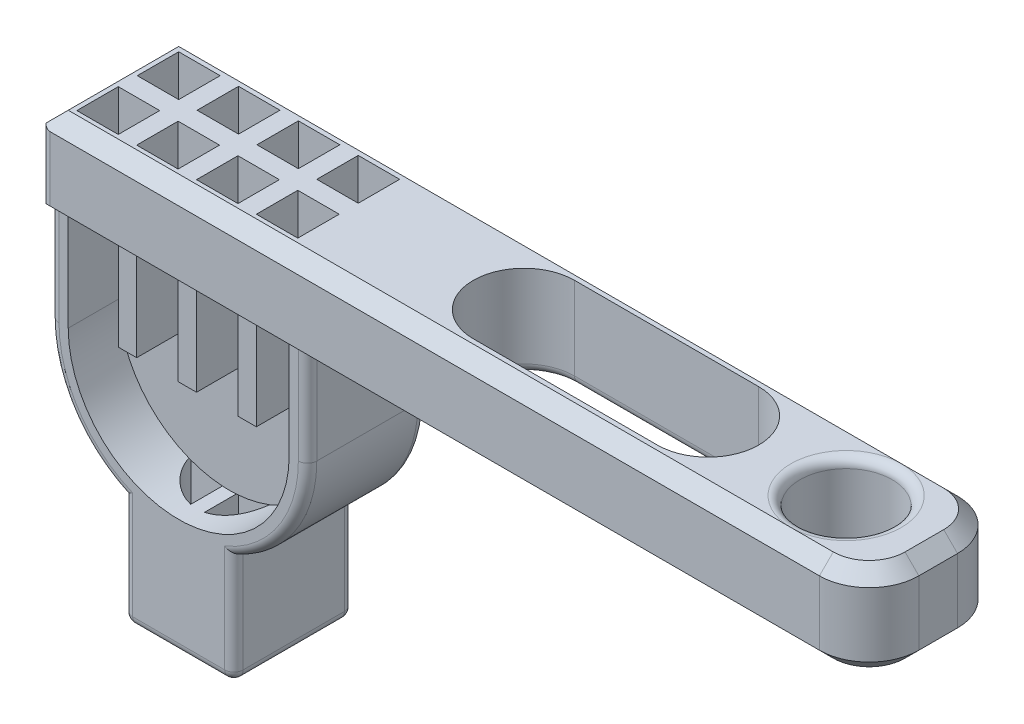
from build123d import *

# Parameters (mm, degrees)
SKETCH1_R                 = 0.5
BOSS_EXTRUDE1_DEPTH       = 1
FILLET1_R                 = 0.1
FILLET3_R                 = 0.54
CHAMFER2_SIZE             = 0.15
CUT_EXTRUDE3_DEPTH        = 1
FILLET4_R                 = 0.1
SKETCH14_3_W              = 0.45
SKETCH14_3_H              = 0.45
CUT_EXTRUDE4_DEPTH        = 10
SKETCH14_W                = 0.2
SKETCH14_H                = 0.2
SKETCH14_H_2              = 0.193588387
SKETCH14_H_3              = 0.45
BOSS_EXTRUDE7_DEPTH       = 1
BOSS_EXTRUDE12_DEPTH      = 0.65
BOSS_EXTRUDE12_DEPTH_BACK = 0.85
BOSS_EXTRUDE13_DEPTH      = 1.5
CUT_EXTRUDE7_DEPTH        = 0.1
CUT_EXTRUDE8_START        = -0.1
CUT_EXTRUDE8_DEPTH        = 0.1
CUT_EXTRUDE9_DEPTH        = 1.35
CHAMFER3_SIZE             = 0.15
FILLET7_R                 = 0.1
BOSS_EXTRUDE14_START      = -0.2
BOSS_EXTRUDE14_DEPTH      = 0.2


with BuildPart() as part:
    # Sketch1 → Boss-Extrude1 (new body)
    with BuildSketch(Plane(origin=(0, 0, 0), x_dir=(1, 0, 0), z_dir=(0, 1, 0))):
        Polygon((1, 0.75), (-2, 0.75), (-8, 0.75), (-8, -0.75), (-2, -0.75), (1, -0.75), align=None)
        with Locations(Location((0, 0, 0), (0, 0, 270))):
            Circle(SKETCH1_R, mode=Mode.SUBTRACT)
    extrude(amount=BOSS_EXTRUDE1_DEPTH)

    # Fillet1
    fillet1_edges = [part.edges().sort_by_distance(p)[0] for p in [
        (0, 1, -0.5),
        (0, 0, -0.5),
    ]]
    fillet(fillet1_edges, radius=FILLET1_R)

    # Fillet3
    fillet3_edges = [part.edges().sort_by_distance(p)[0] for p in [
        (1, 0.5, -0.75),
        (1, 0.5, 0.75),
    ]]
    fillet(fillet3_edges, radius=FILLET3_R)

    # Chamfer2
    chamfer2_edges = [part.edges().sort_by_distance(p)[0] for p in [
        (-8, 1, 0),
        (-3.77, 1, 0.75),
        (-3.77, 1, -0.75),
        (1, 1, 0),
        (0.841837662, 1, 0.591837662),
        (0.841837662, 1, -0.591837662),
    ]]
    chamfer(chamfer2_edges, length=CHAMFER2_SIZE - 0.0001)  # a hair under: the kernel refuses the full size

    # Sketch13 → Cut-Extrude3 (cut)
    with BuildSketch(Plane.XZ):
        with BuildLine():
            Line((-1.5, -0.55), (-3.5, -0.55))
            ThreePointArc((-3.5, -0.55), (-4.05, 0), (-3.5, 0.55))
            Line((-3.5, 0.55), (-1.5, 0.55))
            ThreePointArc((-1.5, 0.55), (-0.95, 0), (-1.5, -0.55))
        make_face()
    extrude(amount=-CUT_EXTRUDE3_DEPTH, mode=Mode.SUBTRACT)

    # Fillet4
    fillet4_edges = [part.edges().sort_by_distance(p)[0] for p in [
        (-0.95, 0, 0),
        (-2.5, 0, 0.55),
        (-4.05, 0, 0),
        (-2.5, 0, -0.55),
    ]]
    fillet(fillet4_edges, radius=FILLET4_R)

    # Sketch14<3> → Cut-Extrude4 (cut)
    with BuildSketch(Plane.XZ):
        with Locations((-7.575, 0.331411613)):
            Rectangle(SKETCH14_3_W, SKETCH14_3_H)
        with Locations((-6.275, 0.331411613)):
            Rectangle(SKETCH14_3_W, SKETCH14_3_H)
        with Locations((-6.275, -0.325)):
            Rectangle(SKETCH14_3_W, SKETCH14_3_H)
        with Locations((-5.625, 0.331411613)):
            Rectangle(SKETCH14_3_W, SKETCH14_3_H)
        with Locations((-7.575, -0.325)):
            Rectangle(SKETCH14_3_W, SKETCH14_3_H)
        with Locations((-6.925, -0.325)):
            Rectangle(SKETCH14_3_W, SKETCH14_3_H)
        with Locations((-6.925, 0.331411613)):
            Rectangle(SKETCH14_3_W, SKETCH14_3_H)
        with Locations((-5.625, -0.325)):
            Rectangle(SKETCH14_3_W, SKETCH14_3_H)
    extrude(amount=-CUT_EXTRUDE4_DEPTH, mode=Mode.SUBTRACT)


with BuildPart() as body_2:
    # Sketch14 → Boss-Extrude7 (new body)
    with BuildSketch(Plane.XZ):
        Polygon((-7.8, -0.55), (-7.8, -0.1), (-7.8, 0.106411613), (-7.8, 0.556411613), (-8, 0.556411613), (-8, -0.55), align=None)
        Polygon((-7.8, 0.106411613), (-7.8, -0.1), (-7.35, -0.1), (-7.35, -0.55), (-7.15, -0.55), (-7.15, -0.1), (-6.7, -0.1), (-6.7, -0.55), (-6.5, -0.55), (-6.5, -0.1), (-6.05, -0.1), (-6.05, -0.55), (-5.85, -0.55), (-5.85, -0.1), (-5.4, -0.1), (-5.4, 0.106411613), (-5.85, 0.106411613), (-5.85, 0.556411613), (-6.05, 0.556411613), (-6.05, 0.106411613), (-6.5, 0.106411613), (-6.5, 0.556411613), (-6.7, 0.556411613), (-6.7, 0.106411613), (-7.15, 0.106411613), (-7.15, 0.556411613), (-7.35, 0.556411613), (-7.35, 0.106411613), align=None)
        with Locations((-7.9, -0.65)):
            Rectangle(SKETCH14_W, SKETCH14_H)
        with Locations((-7.9, 0.653205807)):
            Rectangle(SKETCH14_W, SKETCH14_H_2)
        with Locations((-5.3, -0.65)):
            Rectangle(SKETCH14_W, SKETCH14_H)
        with Locations((-5.3, -0.325)):
            Rectangle(SKETCH14_W, SKETCH14_H_3)
        Polygon((-5.4, 0.106411613), (-5.4, -0.1), (-5.2, -0.1), (-5.2, 0.556411613), (-5.4, 0.556411613), align=None)
        with Locations((-5.3, 0.653205807)):
            Rectangle(SKETCH14_W, SKETCH14_H_2)
    extrude(amount=BOSS_EXTRUDE7_DEPTH)


with BuildPart() as part_1:
    add(part.part)

    # Intersect1: read off the stored shape, not the designer's step
    # Intersect1: union body 2
    add(body_2.part)

    # Sketch22 → Boss-Extrude12 (add, two sides: drawn at the far end of the back side and taken through both)
    with BuildSketch(Plane(origin=(0, 0, -0.1), x_dir=(-1, 0, 0), z_dir=(0, 0, -1)).offset(-BOSS_EXTRUDE12_DEPTH_BACK)):
        with BuildLine():
            Line((7.8, -1), (8, -1))
            ThreePointArc((8, -1), (6.6, -2.4), (5.2, -1))
            Line((5.2, -1), (5.4, -1))
            ThreePointArc((5.4, -1), (6.6, -2.2), (7.8, -1))
        make_face()
    extrude(amount=BOSS_EXTRUDE12_DEPTH + BOSS_EXTRUDE12_DEPTH_BACK)

    # 3DSketch1 → Boss-Extrude13 (add)
    with BuildSketch(Plane(origin=(-7.2, -3.464911064, 0.75), x_dir=(0.7071067811865475, 0.7071067811865477, 0), z_dir=(0, 0, -1))):
        Polygon((0, 0), (0.848528137, 0.848528137), (1.697056275, 0), (0.848528137, -0.848528137), align=None)
    extrude(amount=BOSS_EXTRUDE13_DEPTH)

    # Sketch25 → Cut-Extrude7 (cut)
    with BuildSketch(Plane.XY.offset(0.75)):
        with BuildLine():
            Line((-7.8, -1), (-7.8, 0))
            Line((-7.8, 0), (-8, 0))
            Line((-8, 0), (-8, -1))
            ThreePointArc((-8, -1), (-7.783215957, -1.748331477), (-7.2, -2.264911064))
            Line((-7.2, -2.264911064), (-7.2, -3.464911064))
            Line((-7.2, -3.464911064), (-6, -3.464911064))
            Line((-6, -3.464911064), (-6, -2.264911064))
            ThreePointArc((-6, -2.264911064), (-5.416784043, -1.748331477), (-5.2, -1))
            Line((-5.2, -1), (-5.2, 0))
            Line((-5.2, 0), (-5.4, 0))
            Line((-5.4, 0), (-5.4, -1))
            ThreePointArc((-5.4, -1), (-6.6, -2.2), (-7.8, -1))
        make_face()
    extrude(amount=-CUT_EXTRUDE7_DEPTH, mode=Mode.SUBTRACT)

    # Sketch29 → Cut-Extrude8 (cut)
    with BuildSketch(Plane(origin=(0, 0, -0.75), x_dir=(-1, 0, 0), z_dir=(0, 0, -1)).offset(CUT_EXTRUDE8_START)):
        with BuildLine():
            Line((8, 0), (7.8, 0))
            Line((7.8, 0), (7.8, -1))
            ThreePointArc((7.8, -1), (6.6, -2.2), (5.4, -1))
            Line((5.4, -1), (5.4, 0))
            Line((5.4, 0), (5.2, 0))
            Line((5.2, 0), (5.2, -1))
            ThreePointArc((5.2, -1), (5.416784043, -1.748331477), (6, -2.264911064))
            Line((6, -2.264911064), (6, -3.464911064))
            Line((6, -3.464911064), (7.2, -3.464911064))
            Line((7.2, -3.464911064), (7.2, -2.264911064))
            ThreePointArc((7.2, -2.264911064), (7.783215957, -1.748331477), (8, -1))
            Line((8, -1), (8, 0))
        make_face()
    extrude(amount=CUT_EXTRUDE8_DEPTH, mode=Mode.SUBTRACT)

    # Sketch23 → Cut-Extrude9 (cut)
    with BuildSketch(Plane.XZ.offset(3.464911064)):
        with BuildLine():
            Line((-6.525, 0.443705984), (-6.525, 0.075))
            Line((-6.525, 0.075), (-6.156294016, 0.075))
            ThreePointArc((-6.156294016, 0.075), (-6.281801948, 0.318198052), (-6.525, 0.443705984))
        make_face()
        with BuildLine():
            Line((-6.156294016, -0.075), (-6.525, -0.075))
            Line((-6.525, -0.075), (-6.525, -0.443705984))
            ThreePointArc((-6.525, -0.443705984), (-6.281801948, -0.318198052), (-6.156294016, -0.075))
        make_face()
        with BuildLine():
            Line((-6.675, -0.075), (-7.043705984, -0.075))
            ThreePointArc((-7.043705984, -0.075), (-6.918198052, -0.318198052), (-6.675, -0.443705984))
            Line((-6.675, -0.443705984), (-6.675, -0.075))
        make_face()
        with BuildLine():
            ThreePointArc((-6.675, 0.443705984), (-6.918198052, 0.318198052), (-7.043705984, 0.075))
            Line((-7.043705984, 0.075), (-6.675, 0.075))
            Line((-6.675, 0.075), (-6.675, 0.443705984))
        make_face()
    extrude(amount=-CUT_EXTRUDE9_DEPTH, mode=Mode.SUBTRACT)

    # Chamfer3
    # the kernel refuses this chamfer: 0.15 mm, written as the material it takes off along each edge
    with BuildSketch(Plane(origin=(0.46, 0, 0.75), x_dir=(0, 0, -1), z_dir=(-1, 0, 0))) as chamfer3_piece_1_section:
        Polygon((CHAMFER3_SIZE, 0), (0, -CHAMFER3_SIZE), (0, 0), align=None)
    chamfer3_piece_1 = extrude(amount=8.845752448, mode=Mode.PRIVATE)
    chamfer3_piece_1 = split(chamfer3_piece_1, bisect_by=Plane(origin=(-5.2, 0, 0.75), z_dir=(1, 0, 0)), keep=Keep.TOP, mode=Mode.PRIVATE)
    add(chamfer3_piece_1, mode=Mode.SUBTRACT)
    with BuildSketch(Plane(origin=(0.46, 0, 0.75), x_dir=(0, 0, -1), z_dir=(-1, 0, 0))) as chamfer3_piece_2_section:
        Polygon((CHAMFER3_SIZE, 0), (0, -CHAMFER3_SIZE), (0, 0), align=None)
    chamfer3_piece_2 = extrude(amount=8.845752448, mode=Mode.PRIVATE)
    chamfer3_piece_2 = split(chamfer3_piece_2, bisect_by=Plane(origin=(0.46, 0, 0.65), z_dir=(0, 0, 1)), keep=Keep.TOP, mode=Mode.PRIVATE)
    add(chamfer3_piece_2, mode=Mode.SUBTRACT)
    with BuildSketch(Plane(origin=(0.46, 0, 0.75), x_dir=(0, 0, -1), z_dir=(-1, 0, 0))) as chamfer3_piece_3_section:
        Polygon((CHAMFER3_SIZE, 0), (0, -CHAMFER3_SIZE), (0, 0), align=None)
    chamfer3_piece_3 = extrude(amount=8.845752448, mode=Mode.PRIVATE)
    chamfer3_piece_3 = split(chamfer3_piece_3, bisect_by=Plane(origin=(-5.4, 0, 0.75), z_dir=(-1, 0, 0)), keep=Keep.TOP, mode=Mode.PRIVATE)
    chamfer3_piece_3 = split(chamfer3_piece_3, bisect_by=Plane(origin=(-7.8, 0, 0.75), z_dir=(1, 0, 0)), keep=Keep.TOP, mode=Mode.PRIVATE)
    add(chamfer3_piece_3, mode=Mode.SUBTRACT)
    with BuildSketch(Plane(origin=(0.46, 0, 0.21), x_dir=(0, 0, 1), z_dir=(-1, 0, 0))) as chamfer3_piece_4:
        Polygon((0.54 - CHAMFER3_SIZE, 0), (0.54, CHAMFER3_SIZE), (0.54, 0), align=None)
    revolve(axis=Axis((0.46, 0, 0.21), (0, 1, 0)), revolution_arc=90, mode=Mode.SUBTRACT)
    with BuildSketch(Plane(origin=(1, 0, 0.21), x_dir=(-1, 0, 0), z_dir=(0, 0, -1))) as chamfer3_piece_5:
        Polygon((CHAMFER3_SIZE, 0), (0, CHAMFER3_SIZE), (0, 0), align=None)
    extrude(amount=0.42, mode=Mode.SUBTRACT)
    with BuildSketch(Plane(origin=(0.46, 0, -0.21), x_dir=(0, 0, -1), z_dir=(-1, 0, 0))) as chamfer3_piece_6:
        Polygon((0.54 - CHAMFER3_SIZE, 0), (0.54, -CHAMFER3_SIZE), (0.54, 0), align=None)
    revolve(axis=Axis((0.46, 0, -0.21), (0, -1, 0)), revolution_arc=90, mode=Mode.SUBTRACT)
    with BuildSketch(Plane(origin=(-8.385752448, 0, -0.75), x_dir=(0, 0, 1), z_dir=(1, 0, 0))) as chamfer3_piece_7_section:
        Polygon((CHAMFER3_SIZE, 0), (0, -CHAMFER3_SIZE), (0, 0), align=None)
    chamfer3_piece_7 = extrude(amount=8.845752448, mode=Mode.PRIVATE)
    chamfer3_piece_7 = split(chamfer3_piece_7, bisect_by=Plane(origin=(-7.8, 0, -0.75), z_dir=(1, 0, 0)), keep=Keep.TOP, mode=Mode.PRIVATE)
    chamfer3_piece_7 = split(chamfer3_piece_7, bisect_by=Plane(origin=(-5.4, 0, -0.75), z_dir=(-1, 0, 0)), keep=Keep.TOP, mode=Mode.PRIVATE)
    add(chamfer3_piece_7, mode=Mode.SUBTRACT)
    with BuildSketch(Plane(origin=(-8.385752448, 0, -0.75), x_dir=(0, 0, 1), z_dir=(1, 0, 0))) as chamfer3_piece_8_section:
        Polygon((CHAMFER3_SIZE, 0), (0, -CHAMFER3_SIZE), (0, 0), align=None)
    chamfer3_piece_8 = extrude(amount=8.845752448, mode=Mode.PRIVATE)
    chamfer3_piece_8 = split(chamfer3_piece_8, bisect_by=Plane(origin=(-8.385752448, 0, -0.65), z_dir=(0, 0, -1)), keep=Keep.TOP, mode=Mode.PRIVATE)
    add(chamfer3_piece_8, mode=Mode.SUBTRACT)
    with BuildSketch(Plane(origin=(-8.385752448, 0, -0.75), x_dir=(0, 0, 1), z_dir=(1, 0, 0))) as chamfer3_piece_9_section:
        Polygon((CHAMFER3_SIZE, 0), (0, -CHAMFER3_SIZE), (0, 0), align=None)
    chamfer3_piece_9 = extrude(amount=8.845752448, mode=Mode.PRIVATE)
    chamfer3_piece_9 = split(chamfer3_piece_9, bisect_by=Plane(origin=(-5.2, 0, -0.75), z_dir=(1, 0, 0)), keep=Keep.TOP, mode=Mode.PRIVATE)
    add(chamfer3_piece_9, mode=Mode.SUBTRACT)

    # Fillet7
    # the kernel refuses this fillet: 0.1 mm, written as the material it takes off along each edge
    with BuildSketch(Plane(origin=(-6.1, -3.364911064, 0.55), x_dir=(0, 0, 1), z_dir=(0, -1, 0))) as fillet7_piece_1_section:
        Polygon((0, 0), (FILLET7_R, 0), (FILLET7_R, -FILLET7_R), (0, -FILLET7_R), align=None)
    fillet7_piece_1 = extrude(amount=FILLET7_R, mode=Mode.PRIVATE)
    fillet7_piece_1 = fillet7_piece_1 - Plane(origin=(-6.1, -3.364911064, 0.55), x_dir=(-0.7071067811865475, 0, -0.7071067811865475), z_dir=(0, -1, 0)) * Sphere(FILLET7_R, mode=Mode.PRIVATE)
    add(fillet7_piece_1, mode=Mode.SUBTRACT)
    with BuildSketch(Plane(origin=(-6.1, -3.364911064, -0.55), x_dir=(0, 0, -1), z_dir=(0, -1, 0))) as fillet7_piece_2_section:
        Polygon((0, 0), (FILLET7_R, 0), (FILLET7_R, FILLET7_R), (0, FILLET7_R), align=None)
    fillet7_piece_2 = extrude(amount=FILLET7_R, mode=Mode.PRIVATE)
    fillet7_piece_2 = fillet7_piece_2 - Plane(origin=(-6.1, -3.364911064, -0.55), x_dir=(-0.7071067811865475, 0, 0.7071067811865475), z_dir=(0, -1, 0)) * Sphere(FILLET7_R, mode=Mode.PRIVATE)
    add(fillet7_piece_2, mode=Mode.SUBTRACT)
    with BuildSketch(Plane(origin=(-7.1, -3.364911064, 0.55), x_dir=(0, 0, 1), z_dir=(0, -1, 0))) as fillet7_piece_3_section:
        Polygon((0, 0), (FILLET7_R, 0), (FILLET7_R, FILLET7_R), (0, FILLET7_R), align=None)
    fillet7_piece_3 = extrude(amount=FILLET7_R, mode=Mode.PRIVATE)
    fillet7_piece_3 = fillet7_piece_3 - Plane(origin=(-7.1, -3.364911064, 0.55), x_dir=(0.7071067811865475, 0, -0.7071067811865475), z_dir=(0, -1, 0)) * Sphere(FILLET7_R, mode=Mode.PRIVATE)
    add(fillet7_piece_3, mode=Mode.SUBTRACT)
    with BuildSketch(Plane(origin=(-7.1, -3.364911064, -0.55), x_dir=(0, 0, -1), z_dir=(0, -1, 0))) as fillet7_piece_4_section:
        Polygon((0, 0), (FILLET7_R, 0), (FILLET7_R, -FILLET7_R), (0, -FILLET7_R), align=None)
    fillet7_piece_4 = extrude(amount=FILLET7_R, mode=Mode.PRIVATE)
    fillet7_piece_4 = fillet7_piece_4 - Plane(origin=(-7.1, -3.364911064, -0.55), x_dir=(0.7071067811865475, 0, 0.7071067811865475), z_dir=(0, -1, 0)) * Sphere(FILLET7_R, mode=Mode.PRIVATE)
    add(fillet7_piece_4, mode=Mode.SUBTRACT)
    with BuildSketch(Plane(origin=(-6, -3.464911064, 0.55), x_dir=(0, 1, 0), z_dir=(0, 0, -1)), Plane(origin=(-7.2, -3.464911064, 0.55), x_dir=(1, 0, 0), z_dir=(0, 0, -1))) as fillet7_piece_5:
        with BuildLine():
            CenterArc((FILLET7_R, -FILLET7_R), FILLET7_R, 90, 90)
            Line((0, -FILLET7_R), (0, 0))
            Line((0, 0), (FILLET7_R, 0))
        make_face()
    extrude(amount=1.1, mode=Mode.SUBTRACT)
    with BuildSketch(Plane(origin=(-5.2, 0.3, 0.65), x_dir=(-1, 0, 0), z_dir=(0, -1, 0))) as fillet7_piece_6_section:
        with BuildLine():
            CenterArc((FILLET7_R, FILLET7_R), FILLET7_R, 180, 90)
            Line((0, FILLET7_R), (0, 0))
            Line((0, 0), (FILLET7_R, 0))
        make_face()
    fillet7_piece_6 = extrude(amount=1.3, mode=Mode.PRIVATE)
    fillet7_piece_6 = split(fillet7_piece_6, bisect_by=Plane(origin=(-5.2, 0.175, 0.775), z_dir=(0, 0.7071067811865476, -0.7071067811865476)), keep=Keep.TOP, mode=Mode.PRIVATE)
    fillet7_piece_6 = split(fillet7_piece_6, bisect_by=Plane(origin=(-5.2, 0, 0.65), z_dir=(0, -1, 0)), keep=Keep.TOP, mode=Mode.PRIVATE)
    add(fillet7_piece_6, mode=Mode.SUBTRACT)
    with BuildSketch(Plane(origin=(-5.2, 0.3, 0.65), x_dir=(-1, 0, 0), z_dir=(0, -1, 0))) as fillet7_piece_7_section:
        with BuildLine():
            CenterArc((FILLET7_R, FILLET7_R), FILLET7_R, 180, 90)
            Line((0, FILLET7_R), (0, 0))
            Line((0, 0), (FILLET7_R, 0))
        make_face()
    fillet7_piece_7 = extrude(amount=1.3, mode=Mode.PRIVATE)
    fillet7_piece_7 = split(fillet7_piece_7, bisect_by=Plane(origin=(-5.2, 0.175, 0.775), z_dir=(0, -0.7071067811865476, 0.7071067811865476)), keep=Keep.TOP, mode=Mode.PRIVATE)
    fillet7_piece_7 = split(fillet7_piece_7, bisect_by=Plane(origin=(-5.2, 0, 0.65), z_dir=(0, 1, 0)), keep=Keep.TOP, mode=Mode.PRIVATE)
    add(fillet7_piece_7, mode=Mode.SUBTRACT)
    with BuildSketch(Plane(origin=(-5.2, 0.3, 0.65), x_dir=(-1, 0, 0), z_dir=(0, -1, 0))) as fillet7_piece_8_section:
        with BuildLine():
            CenterArc((FILLET7_R, FILLET7_R), FILLET7_R, 180, 90)
            Line((0, FILLET7_R), (0, 0))
            Line((0, 0), (FILLET7_R, 0))
        make_face()
    fillet7_piece_8 = extrude(amount=1.3, mode=Mode.PRIVATE)
    fillet7_piece_8 = split(fillet7_piece_8, bisect_by=Plane(origin=(-5.2, 0.175, 0.775), z_dir=(0, -0.7071067811865476, 0.7071067811865476)), keep=Keep.TOP, mode=Mode.PRIVATE)
    fillet7_piece_8 = split(fillet7_piece_8, bisect_by=Plane(origin=(-5.2, 0, 0.65), z_dir=(0, -1, 0)), keep=Keep.TOP, mode=Mode.PRIVATE)
    add(fillet7_piece_8, mode=Mode.SUBTRACT)
    with BuildSketch(Plane(origin=(-6.6, -1, 0.65), x_dir=(0.2612361843672163, -0.9652749121246537, 0), z_dir=(-0.9652749121246537, -0.2612361843672163, 0))) as fillet7_piece_9_section:
        with BuildLine():
            CenterArc((1.4 - FILLET7_R, -FILLET7_R), FILLET7_R, 0, 90)
            Line((1.4, -FILLET7_R), (1.4, 0))
            Line((1.4, 0), (1.4 - FILLET7_R, 0))
        make_face()
    fillet7_piece_9 = revolve(axis=Axis((-6.6, -1, 0.65), (0, 0, 1)), revolution_arc=74.856574406, mode=Mode.PRIVATE)
    fillet7_piece_9 = split(fillet7_piece_9, bisect_by=Plane(origin=(-6, -1, 0.65), z_dir=(1, 0, 0)), keep=Keep.TOP, mode=Mode.PRIVATE)
    add(fillet7_piece_9, mode=Mode.SUBTRACT)
    with BuildSketch(Plane(origin=(-6, -3.364911064, 0.65), x_dir=(-1, 0, 0), z_dir=(0, 1, 0))) as fillet7_piece_10_section:
        with BuildLine():
            CenterArc((FILLET7_R, -FILLET7_R), FILLET7_R, 90, 90)
            Line((0, -FILLET7_R), (0, 0))
            Line((0, 0), (FILLET7_R, 0))
        make_face()
    fillet7_piece_10 = extrude(amount=1.35, mode=Mode.PRIVATE)
    fillet7_piece_10 = fillet7_piece_10 - Plane(origin=(-6.6, -1, 0.65), x_dir=(-1, 0, 0), z_dir=(0, 0, 1)) * Cylinder(1.4, 4, mode=Mode.PRIVATE)
    add(fillet7_piece_10, mode=Mode.SUBTRACT)
    with BuildSketch(Plane(origin=(-7.1, -3.464911064, 0.65), x_dir=(0, 1, 0), z_dir=(1, 0, 0))) as fillet7_piece_11:
        with BuildLine():
            CenterArc((FILLET7_R, -FILLET7_R), FILLET7_R, 90, 90)
            Line((0, -FILLET7_R), (0, 0))
            Line((0, 0), (FILLET7_R, 0))
        make_face()
    extrude(amount=1, mode=Mode.SUBTRACT)
    with BuildSketch(Plane(origin=(-7.2, -2.014911064, 0.65), x_dir=(1, 0, 0), z_dir=(0, -1, 0))) as fillet7_piece_12_section:
        with BuildLine():
            CenterArc((FILLET7_R, -FILLET7_R), FILLET7_R, 90, 90)
            Line((0, -FILLET7_R), (0, 0))
            Line((0, 0), (FILLET7_R, 0))
        make_face()
    fillet7_piece_12 = extrude(amount=1.35, mode=Mode.PRIVATE)
    fillet7_piece_12 = fillet7_piece_12 - Plane(origin=(-6.6, -1, 0.65), x_dir=(-1, 0, 0), z_dir=(0, 0, 1)) * Cylinder(1.4, 4, mode=Mode.PRIVATE)
    add(fillet7_piece_12, mode=Mode.SUBTRACT)
    with BuildSketch(Plane(origin=(-6.6, -1, 0.65), x_dir=(-1, 0, 0), z_dir=(0, 1, 0))) as fillet7_piece_13_section:
        with BuildLine():
            CenterArc((1.4 - FILLET7_R, -FILLET7_R), FILLET7_R, 0, 90)
            Line((1.4, -FILLET7_R), (1.4, 0))
            Line((1.4, 0), (1.4 - FILLET7_R, 0))
        make_face()
    fillet7_piece_13 = revolve(axis=Axis((-6.6, -1, 0.65), (0, 0, 1)), revolution_arc=74.856574406, mode=Mode.PRIVATE)
    fillet7_piece_13 = split(fillet7_piece_13, bisect_by=Plane(origin=(-7.2, -1, 0.65), z_dir=(-1, 0, 0)), keep=Keep.TOP, mode=Mode.PRIVATE)
    add(fillet7_piece_13, mode=Mode.SUBTRACT)
    with BuildSketch(Plane(origin=(-8, -1, 0.65), x_dir=(1, 0, 0), z_dir=(0, 1, 0))) as fillet7_piece_14_section:
        with BuildLine():
            CenterArc((FILLET7_R, FILLET7_R), FILLET7_R, 180, 90)
            Line((0, FILLET7_R), (0, 0))
            Line((0, 0), (FILLET7_R, 0))
        make_face()
    fillet7_piece_14 = extrude(amount=1.3, mode=Mode.PRIVATE)
    fillet7_piece_14 = split(fillet7_piece_14, bisect_by=Plane(origin=(-8, -0.475, 0.125), z_dir=(0, -0.7071067811865476, 0.7071067811865476)), keep=Keep.TOP, mode=Mode.PRIVATE)
    add(fillet7_piece_14, mode=Mode.SUBTRACT)
    with BuildSketch(Plane(origin=(-8, -1, -0.65), x_dir=(1, 0, 0), z_dir=(0, 1, 0))) as fillet7_piece_15_section:
        with BuildLine():
            CenterArc((FILLET7_R, -FILLET7_R), FILLET7_R, 90, 90)
            Line((0, -FILLET7_R), (0, 0))
            Line((0, 0), (FILLET7_R, 0))
        make_face()
    fillet7_piece_15 = extrude(amount=1.3, mode=Mode.PRIVATE)
    fillet7_piece_15 = split(fillet7_piece_15, bisect_by=Plane(origin=(-8, -0.475, -0.125), z_dir=(0, -0.7071067811865476, -0.7071067811865476)), keep=Keep.TOP, mode=Mode.PRIVATE)
    add(fillet7_piece_15, mode=Mode.SUBTRACT)
    with BuildSketch(Plane(origin=(-6.6, -1, -0.65), x_dir=(-0.26123618436721385, -0.9652749121246543, 0), z_dir=(0.9652749121246543, -0.26123618436721385, 0))) as fillet7_piece_16_section:
        with BuildLine():
            CenterArc((1.4 - FILLET7_R, -FILLET7_R), FILLET7_R, 0, 90)
            Line((1.4 - FILLET7_R, 0), (1.4, 0))
            Line((1.4, 0), (1.4, -FILLET7_R))
        make_face()
    fillet7_piece_16 = revolve(axis=Axis((-6.6, -1, -0.65), (0, 0, -1)), revolution_arc=74.856574406, mode=Mode.PRIVATE)
    fillet7_piece_16 = split(fillet7_piece_16, bisect_by=Plane(origin=(-7.2, -1, -0.65), z_dir=(-1, 0, 0)), keep=Keep.TOP, mode=Mode.PRIVATE)
    add(fillet7_piece_16, mode=Mode.SUBTRACT)
    with BuildSketch(Plane(origin=(-7.2, -3.364911064, -0.65), x_dir=(0, 0, 1), z_dir=(0, 1, 0))) as fillet7_piece_17_section:
        with BuildLine():
            CenterArc((FILLET7_R, FILLET7_R), FILLET7_R, 180, 90)
            Line((0, FILLET7_R), (0, 0))
            Line((0, 0), (FILLET7_R, 0))
        make_face()
    fillet7_piece_17 = extrude(amount=1.35, mode=Mode.PRIVATE)
    fillet7_piece_17 = fillet7_piece_17 - Plane(origin=(-6.6, -1, -0.65), x_dir=(-1, 0, 0), z_dir=(0, 0, 1)) * Cylinder(1.4, 4, mode=Mode.PRIVATE)
    add(fillet7_piece_17, mode=Mode.SUBTRACT)
    with BuildSketch(Plane(origin=(-6.1, -3.464911064, -0.65), x_dir=(0, 0, 1), z_dir=(-1, 0, 0))) as fillet7_piece_18:
        with BuildLine():
            CenterArc((FILLET7_R, FILLET7_R), FILLET7_R, 180, 90)
            Line((0, FILLET7_R), (0, 0))
            Line((0, 0), (FILLET7_R, 0))
        make_face()
    extrude(amount=1, mode=Mode.SUBTRACT)
    with BuildSketch(Plane(origin=(-6, -2.014911064, -0.65), x_dir=(0, 0, 1), z_dir=(0, -1, 0))) as fillet7_piece_19_section:
        with BuildLine():
            CenterArc((FILLET7_R, FILLET7_R), FILLET7_R, 180, 90)
            Line((0, FILLET7_R), (0, 0))
            Line((0, 0), (FILLET7_R, 0))
        make_face()
    fillet7_piece_19 = extrude(amount=1.35, mode=Mode.PRIVATE)
    fillet7_piece_19 = fillet7_piece_19 - Plane(origin=(-6.6, -1, -0.65), x_dir=(-1, 0, 0), z_dir=(0, 0, 1)) * Cylinder(1.4, 4, mode=Mode.PRIVATE)
    add(fillet7_piece_19, mode=Mode.SUBTRACT)
    with BuildSketch(Plane(origin=(-6.6, -1, -0.65), x_dir=(1, 0, 0), z_dir=(0, 1, 0))) as fillet7_piece_20_section:
        with BuildLine():
            CenterArc((1.4 - FILLET7_R, -FILLET7_R), FILLET7_R, 360, 90)
            Line((1.4 - FILLET7_R, 0), (1.4, 0))
            Line((1.4, 0), (1.4, -FILLET7_R))
        make_face()
    fillet7_piece_20 = revolve(axis=Axis((-6.6, -1, -0.65), (0, 0, -1)), revolution_arc=74.856574406, mode=Mode.PRIVATE)
    fillet7_piece_20 = split(fillet7_piece_20, bisect_by=Plane(origin=(-6, -1, -0.65), z_dir=(1, 0, 0)), keep=Keep.TOP, mode=Mode.PRIVATE)
    add(fillet7_piece_20, mode=Mode.SUBTRACT)
    with BuildSketch(Plane(origin=(-5.2, -1, -0.65), x_dir=(-1, 0, 0), z_dir=(0, 1, 0))) as fillet7_piece_21_section:
        with BuildLine():
            CenterArc((FILLET7_R, FILLET7_R), FILLET7_R, 180, 90)
            Line((0, FILLET7_R), (0, 0))
            Line((0, 0), (FILLET7_R, 0))
        make_face()
    fillet7_piece_21 = extrude(amount=1.3, mode=Mode.PRIVATE)
    fillet7_piece_21 = split(fillet7_piece_21, bisect_by=Plane(origin=(-5.2, -0.475, -0.125), z_dir=(0, -0.7071067811865476, -0.7071067811865476)), keep=Keep.TOP, mode=Mode.PRIVATE)
    fillet7_piece_21 = split(fillet7_piece_21, bisect_by=Plane(origin=(-5.2, 0, -0.65), z_dir=(0, -1, 0)), keep=Keep.TOP, mode=Mode.PRIVATE)
    add(fillet7_piece_21, mode=Mode.SUBTRACT)
    with BuildSketch(Plane(origin=(-5.2, -1, -0.65), x_dir=(-1, 0, 0), z_dir=(0, 1, 0))) as fillet7_piece_22_section:
        with BuildLine():
            CenterArc((FILLET7_R, FILLET7_R), FILLET7_R, 180, 90)
            Line((0, FILLET7_R), (0, 0))
            Line((0, 0), (FILLET7_R, 0))
        make_face()
    fillet7_piece_22 = extrude(amount=1.3, mode=Mode.PRIVATE)
    fillet7_piece_22 = split(fillet7_piece_22, bisect_by=Plane(origin=(-5.2, -0.475, -0.125), z_dir=(0, 0.7071067811865476, 0.7071067811865476)), keep=Keep.TOP, mode=Mode.PRIVATE)
    fillet7_piece_22 = split(fillet7_piece_22, bisect_by=Plane(origin=(-5.2, 0, -0.65), z_dir=(0, -1, 0)), keep=Keep.TOP, mode=Mode.PRIVATE)
    add(fillet7_piece_22, mode=Mode.SUBTRACT)
    with BuildSketch(Plane(origin=(-5.2, -1, -0.65), x_dir=(-1, 0, 0), z_dir=(0, 1, 0))) as fillet7_piece_23_section:
        with BuildLine():
            CenterArc((FILLET7_R, FILLET7_R), FILLET7_R, 180, 90)
            Line((0, FILLET7_R), (0, 0))
            Line((0, 0), (FILLET7_R, 0))
        make_face()
    fillet7_piece_23 = extrude(amount=1.3, mode=Mode.PRIVATE)
    fillet7_piece_23 = split(fillet7_piece_23, bisect_by=Plane(origin=(-5.2, -0.475, -0.125), z_dir=(0, -0.7071067811865476, -0.7071067811865476)), keep=Keep.TOP, mode=Mode.PRIVATE)
    fillet7_piece_23 = split(fillet7_piece_23, bisect_by=Plane(origin=(-5.2, 0, -0.65), z_dir=(0, 1, 0)), keep=Keep.TOP, mode=Mode.PRIVATE)
    add(fillet7_piece_23, mode=Mode.SUBTRACT)
    with BuildSketch(Plane(origin=(-8, 1.1001, 0.75), x_dir=(1, 0, 0), z_dir=(0, -1, 0))) as fillet7_piece_24:
        with BuildLine():
            CenterArc((FILLET7_R, -FILLET7_R), FILLET7_R, 90, 90)
            Line((0, -FILLET7_R), (0, 0))
            Line((0, 0), (FILLET7_R, 0))
        make_face()
    extrude(amount=1.2001, mode=Mode.SUBTRACT)
    with BuildSketch(Plane(origin=(-8, -0.1, -0.75), x_dir=(0, 0, 1), z_dir=(0, 1, 0))) as fillet7_piece_25:
        with BuildLine():
            CenterArc((FILLET7_R, FILLET7_R), FILLET7_R, 180, 90)
            Line((0, FILLET7_R), (0, 0))
            Line((0, 0), (FILLET7_R, 0))
        make_face()
    extrude(amount=1.2001, mode=Mode.SUBTRACT)
    with BuildSketch(Plane(origin=(-6, -3.364911064, 0.65), x_dir=(-1, 0, 0), z_dir=(0, 1, 0))) as fillet7_piece_26a_section:
        with BuildLine():
            CenterArc((FILLET7_R, -FILLET7_R), FILLET7_R, 90, 90)
            Line((0, -FILLET7_R), (0, 0))
            Line((0, 0), (FILLET7_R, 0))
        make_face()
    fillet7_piece_26a = extrude(amount=1.35, mode=Mode.PRIVATE)
    fillet7_piece_26a = fillet7_piece_26a & Plane(origin=(-6.6, -1, 0.65), x_dir=(-1, 0, 0), z_dir=(0, 0, 1)) * Cylinder(1.4, 4, mode=Mode.PRIVATE)
    with BuildSketch(Plane(origin=(-6.6, -1, 0.65), x_dir=(0.2612361843672163, -0.9652749121246537, 0), z_dir=(-0.9652749121246537, -0.2612361843672163, 0))) as fillet7_piece_26b_section:
        with BuildLine():
            CenterArc((1.4 - FILLET7_R, -FILLET7_R), FILLET7_R, 0, 90)
            Line((1.4, -FILLET7_R), (1.4, 0))
            Line((1.4, 0), (1.4 - FILLET7_R, 0))
        make_face()
    fillet7_piece_26b = revolve(axis=Axis((-6.6, -1, 0.65), (0, 0, 1)), revolution_arc=74.856574406, mode=Mode.PRIVATE)
    fillet7_piece_26b = split(fillet7_piece_26b, bisect_by=Plane(origin=(-6, -1, 0.65), z_dir=(-1, 0, 0)), keep=Keep.TOP, mode=Mode.PRIVATE)
    fillet7_piece_26 = fillet7_piece_26a & fillet7_piece_26b
    add(fillet7_piece_26, mode=Mode.SUBTRACT)
    with BuildSketch(Plane(origin=(-6.6, -1, 0.65), x_dir=(-1, 0, 0), z_dir=(0, 1, 0))) as fillet7_piece_27a_section:
        with BuildLine():
            CenterArc((1.4 - FILLET7_R, -FILLET7_R), FILLET7_R, 0, 90)
            Line((1.4, -FILLET7_R), (1.4, 0))
            Line((1.4, 0), (1.4 - FILLET7_R, 0))
        make_face()
    fillet7_piece_27a = revolve(axis=Axis((-6.6, -1, 0.65), (0, 0, 1)), revolution_arc=74.856574406, mode=Mode.PRIVATE)
    fillet7_piece_27a = split(fillet7_piece_27a, bisect_by=Plane(origin=(-7.2, -1, 0.65), z_dir=(1, 0, 0)), keep=Keep.TOP, mode=Mode.PRIVATE)
    with BuildSketch(Plane(origin=(-7.2, -2.014911064, 0.65), x_dir=(1, 0, 0), z_dir=(0, -1, 0))) as fillet7_piece_27b_section:
        with BuildLine():
            CenterArc((FILLET7_R, -FILLET7_R), FILLET7_R, 90, 90)
            Line((0, -FILLET7_R), (0, 0))
            Line((0, 0), (FILLET7_R, 0))
        make_face()
    fillet7_piece_27b = extrude(amount=1.35, mode=Mode.PRIVATE)
    fillet7_piece_27b = fillet7_piece_27b & Plane(origin=(-6.6, -1, 0.65), x_dir=(-1, 0, 0), z_dir=(0, 0, 1)) * Cylinder(1.4, 4, mode=Mode.PRIVATE)
    fillet7_piece_27 = fillet7_piece_27a & fillet7_piece_27b
    add(fillet7_piece_27, mode=Mode.SUBTRACT)
    with BuildSketch(Plane(origin=(-7.2, -3.364911064, -0.65), x_dir=(0, 0, 1), z_dir=(0, 1, 0))) as fillet7_piece_28a_section:
        with BuildLine():
            CenterArc((FILLET7_R, FILLET7_R), FILLET7_R, 180, 90)
            Line((0, FILLET7_R), (0, 0))
            Line((0, 0), (FILLET7_R, 0))
        make_face()
    fillet7_piece_28a = extrude(amount=1.35, mode=Mode.PRIVATE)
    fillet7_piece_28a = fillet7_piece_28a & Plane(origin=(-6.6, -1, -0.65), x_dir=(-1, 0, 0), z_dir=(0, 0, 1)) * Cylinder(1.4, 4, mode=Mode.PRIVATE)
    with BuildSketch(Plane(origin=(-6.6, -1, -0.65), x_dir=(-0.26123618436721385, -0.9652749121246543, 0), z_dir=(0.9652749121246543, -0.26123618436721385, 0))) as fillet7_piece_28b_section:
        with BuildLine():
            CenterArc((1.4 - FILLET7_R, -FILLET7_R), FILLET7_R, 0, 90)
            Line((1.4 - FILLET7_R, 0), (1.4, 0))
            Line((1.4, 0), (1.4, -FILLET7_R))
        make_face()
    fillet7_piece_28b = revolve(axis=Axis((-6.6, -1, -0.65), (0, 0, -1)), revolution_arc=74.856574406, mode=Mode.PRIVATE)
    fillet7_piece_28b = split(fillet7_piece_28b, bisect_by=Plane(origin=(-7.2, -1, -0.65), z_dir=(1, 0, 0)), keep=Keep.TOP, mode=Mode.PRIVATE)
    fillet7_piece_28 = fillet7_piece_28a & fillet7_piece_28b
    add(fillet7_piece_28, mode=Mode.SUBTRACT)
    with BuildSketch(Plane(origin=(-6.6, -1, -0.65), x_dir=(1, 0, 0), z_dir=(0, 1, 0))) as fillet7_piece_29a_section:
        with BuildLine():
            CenterArc((1.4 - FILLET7_R, -FILLET7_R), FILLET7_R, 360, 90)
            Line((1.4 - FILLET7_R, 0), (1.4, 0))
            Line((1.4, 0), (1.4, -FILLET7_R))
        make_face()
    fillet7_piece_29a = revolve(axis=Axis((-6.6, -1, -0.65), (0, 0, -1)), revolution_arc=74.856574406, mode=Mode.PRIVATE)
    fillet7_piece_29a = split(fillet7_piece_29a, bisect_by=Plane(origin=(-6, -1, -0.65), z_dir=(-1, 0, 0)), keep=Keep.TOP, mode=Mode.PRIVATE)
    with BuildSketch(Plane(origin=(-6, -2.014911064, -0.65), x_dir=(0, 0, 1), z_dir=(0, -1, 0))) as fillet7_piece_29b_section:
        with BuildLine():
            CenterArc((FILLET7_R, FILLET7_R), FILLET7_R, 180, 90)
            Line((0, FILLET7_R), (0, 0))
            Line((0, 0), (FILLET7_R, 0))
        make_face()
    fillet7_piece_29b = extrude(amount=1.35, mode=Mode.PRIVATE)
    fillet7_piece_29b = fillet7_piece_29b & Plane(origin=(-6.6, -1, -0.65), x_dir=(-1, 0, 0), z_dir=(0, 0, 1)) * Cylinder(1.4, 4, mode=Mode.PRIVATE)
    fillet7_piece_29 = fillet7_piece_29a & fillet7_piece_29b
    add(fillet7_piece_29, mode=Mode.SUBTRACT)

    # Sketch30 → Boss-Extrude14 (add)
    with BuildSketch(Plane(origin=(0, 0, -0.1), x_dir=(-1, 0, 0), z_dir=(0, 0, -1)).offset(BOSS_EXTRUDE14_START)):
        with BuildLine():
            Line((5.4, -1), (7.8, -1))
            ThreePointArc((7.8, -1), (6.6, -2.2), (5.4, -1))
        make_face()
    extrude(amount=BOSS_EXTRUDE14_DEPTH)


solid = part_1.part
